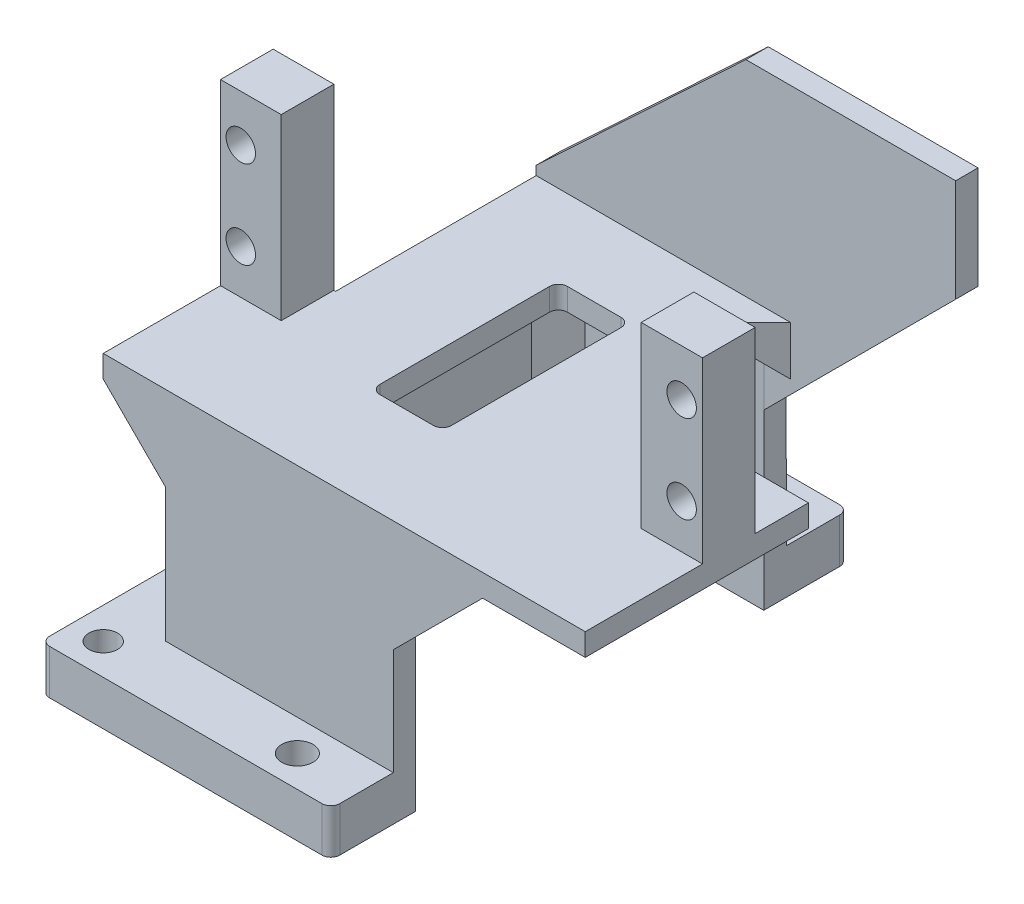
from build123d import *

# Parameters (mm, degrees)
BOSS_EXTRUDE1_DEPTH  = 3.5
BOSS_EXTRUDE2_DEPTH  = 21
SKETCH3_W            = 23
SKETCH3_H            = 39
BOSS_EXTRUDE3_DEPTH  = 2.5
SKETCH5_W            = 21.5
SKETCH5_H            = 25
SKETCH5_W_2          = 7.07
SKETCH5_H_2          = 19.04
BOSS_EXTRUDE5_DEPTH  = 2.5
SKETCH6_W            = 7.07
SKETCH6_H            = 5.9
BOSS_EXTRUDE6_DEPTH  = 20
BOSS_EXTRUDE7_DEPTH  = 23
FILLET1_SIZE         = 10
SKETCH9_R            = 2.475
BOSS_EXTRUDE8_DEPTH  = 9
FILLET2_R            = 0.5
SKETCH10_R           = 1.65
CUT_EXTRUDE1_DEPTH   = 9
SKETCH11_W           = 0.2
SKETCH11_H           = 20
CUT_EXTRUDE2_DEPTH   = 9
CUT_EXTRUDE3_DEPTH   = 9
FILLET3_SIZE         = 3
BOSS_EXTRUDE9_DEPTH  = 5
SKETCH14_R           = 1.747814763
SKETCH14_R_2         = 1.6
CUT_EXTRUDE4_DEPTH   = 15
SKETCH15_W           = 110
SKETCH15_H           = 3.5
CUT_EXTRUDE5_DEPTH   = 150
FILLET4_SIZE         = 7
FILLET5_SIZE         = 3
FILLET6_SIZE         = 3
SKETCH17_W           = 8
SKETCH17_H           = 21
CUT_EXTRUDE6_DEPTH   = 150
FILLET7_R            = 1
FILLET9_SIZE         = 3
SKETCH19_R           = 1.747814763
SKETCH19_R_2         = 1.6
BOSS_EXTRUDE10_DEPTH = 8.43
CUT_EXTRUDE7_DEPTH   = 8.43
FILLET10_R           = 1


# Some blends are built 0.0001 mm under size
with BuildPart() as part:
    # Sketch1 → Boss-Extrude1 (new body)
    with BuildSketch(Plane(origin=(0, 0, 0), x_dir=(1, 0, 0), z_dir=(0, 1, 0))):
        Polygon((0, 40), (23, 40), (23, 79), (0, 79), (0, 100), (110, 100), (110, 79), (87, 79), (87, 40), (110, 40), (110, 20), (80, 0), (30, 0), (0, 20), align=None)
    extrude(amount=BOSS_EXTRUDE1_DEPTH)

    # Sketch2 → Boss-Extrude2 (add)
    with BuildSketch(Plane(origin=(0, 3.5, 0), x_dir=(1, 0, 0), z_dir=(0, 1, 0))):
        Polygon((0, 79), (23, 79), (23, 40), (0, 40), (0, 37.5), (25.5, 37.5), (25.5, 81.5), (0, 81.5), align=None)
        Polygon((110, 81.5), (84.5, 81.5), (84.5, 37.5), (110, 37.5), (110, 40), (87, 40), (87, 79), (110, 79), align=None)
    extrude(amount=BOSS_EXTRUDE2_DEPTH)

    # Sketch3 → Boss-Extrude3 (add)
    with BuildSketch(Plane(origin=(0, 24.5, 0), x_dir=(1, 0, 0), z_dir=(0, 1, 0))):
        with Locations((11.5, 59.5)):
            Rectangle(SKETCH3_W, SKETCH3_H)
        with Locations((98.5, 59.5)):
            Rectangle(SKETCH3_W, SKETCH3_H)
    extrude(amount=-BOSS_EXTRUDE3_DEPTH)

    # Sketch5 → Boss-Extrude5 (add)
    with BuildSketch(Plane(origin=(0, 24.5, 0), x_dir=(1, 0, 0), z_dir=(0, 1, 0))):
        with Locations((120.75, 50)):
            Rectangle(SKETCH5_W, SKETCH5_H)
        with Locations((-10.75, 50)):
            Rectangle(SKETCH5_W, SKETCH5_H)
        with Locations((29.035, 47.02)):
            Rectangle(SKETCH5_W_2, SKETCH5_H_2)
        with Locations((80.965, 47.02)):
            Rectangle(SKETCH5_W_2, SKETCH5_H_2)
    extrude(amount=-BOSS_EXTRUDE5_DEPTH)

    # Sketch6 → Boss-Extrude6 (add)
    with BuildSketch(Plane(origin=(0, 24.5, 0), x_dir=(1, 0, 0), z_dir=(0, 1, 0))):
        with Locations((29.035, 53.59)):
            Rectangle(SKETCH6_W, SKETCH6_H)
        with Locations((80.965, 53.59)):
            Rectangle(SKETCH6_W, SKETCH6_H)
        with Locations((-17.965, 53.59)):
            Rectangle(SKETCH6_W, SKETCH6_H)
        with Locations((127.965, 53.59)):
            Rectangle(SKETCH6_W, SKETCH6_H)
    extrude(amount=BOSS_EXTRUDE6_DEPTH)

    # Sketch7 → Boss-Extrude7 (add)
    with BuildSketch(Plane(origin=(0, 24.5, 0), x_dir=(1, 0, 0), z_dir=(0, 1, 0))):
        Polygon((0, 81.5), (25.5, 81.5), (25.5, 79), (0, 79), (-21.5, 79), (-21.5, 81.5), align=None)
        Polygon((110, 79), (84.5, 79), (84.5, 81.5), (110, 81.5), (131.5, 81.5), (131.5, 79), align=None)
    extrude(amount=BOSS_EXTRUDE7_DEPTH)

    # Fillet1
    # the kernel refuses this chamfer: 10 mm, written as the material it adds along each edge
    with BuildSketch(Plane(origin=(0, 22, -40), x_dir=(0.027495876610586372, -0.9996219169112968, 0), z_dir=(0, 0, 1)), Plane(origin=(110, 22, -37.5), x_dir=(-0.027495876610586317, -0.9996219169112968, 0), z_dir=(0, 0, -1)), Plane(origin=(110, 24.5, -81.5), x_dir=(0.9996219169112968, 0.027495876610586317, 0), z_dir=(0, 0, 1))) as fillet1_piece_1:
        Polygon((FILLET1_SIZE * 0.999621916911, -FILLET1_SIZE * 0.0274958766106), (-FILLET1_SIZE * 0.0274958766106, -FILLET1_SIZE * 0.999621916911), (0, 0), align=None)
    extrude(amount=2.5)
    with BuildSketch(Plane(origin=(0, 24.5, -79), x_dir=(0.027495876610586372, -0.9996219169112968, 0), z_dir=(0, 0, -1))) as fillet1_piece_2:
        Polygon((FILLET1_SIZE * 0.999621916911, FILLET1_SIZE * 0.0274958766106), (-FILLET1_SIZE * 0.0274958766106, FILLET1_SIZE * 0.999621916911), (0, 0), align=None)
    extrude(amount=2.5)

    # Sketch9 → Boss-Extrude8 (add)
    with BuildSketch(Plane(origin=(0, 0, -81.5), x_dir=(-1, 0, 0), z_dir=(0, 0, -1))):
        with Locations(Location((-114.55, 34.35, 0), (0, 0, 180))):
            Circle(SKETCH9_R)
        with Locations(Location((4.55, 34.35, 0), (0, 0, 180))):
            Circle(SKETCH9_R)
    extrude(amount=BOSS_EXTRUDE8_DEPTH)

    # Fillet2
    fillet2_edges = [part.edges().sort_by_distance(p)[0] for p in [
        (112.075, 34.35, -90.5),
        (-7.025, 34.35, -90.5),
    ]]
    fillet(fillet2_edges, radius=FILLET2_R)

    # Sketch10 → Cut-Extrude1 (cut)
    with BuildSketch(Plane.XY.offset(-50.64)):
        with Locations((129.16, 39.27)):
            Circle(SKETCH10_R)
        with Locations((129.16, 29.43)):
            Circle(SKETCH10_R)
        with Locations((79.77, 39.27)):
            Circle(SKETCH10_R)
        with Locations((79.77, 29.43)):
            Circle(SKETCH10_R)
        with Locations((-19.16, 29.43)):
            Circle(SKETCH10_R)
        with Locations((-19.16, 39.27)):
            Circle(SKETCH10_R)
        with Locations(Location((30.23, 39.27, 0), (0, 0, 180))):
            Circle(SKETCH10_R)
        with Locations(Location((30.23, 29.43, 0), (0, 0, 180))):
            Circle(SKETCH10_R)
    extrude(amount=-CUT_EXTRUDE1_DEPTH, mode=Mode.SUBTRACT)

    # Sketch11 → Cut-Extrude2 (cut)
    with BuildSketch(Plane.XY.offset(-50.64)):
        with Locations((-14.53, 34.5)):
            Rectangle(SKETCH11_W, SKETCH11_H)
        with Locations((25.6, 34.5)):
            Rectangle(SKETCH11_W, SKETCH11_H)
        with Locations((84.4, 34.5)):
            Rectangle(SKETCH11_W, SKETCH11_H)
        with Locations((124.53, 34.5)):
            Rectangle(SKETCH11_W, SKETCH11_H)
    extrude(amount=-CUT_EXTRUDE2_DEPTH, mode=Mode.SUBTRACT)

    # Sketch12 → Cut-Extrude3 (cut)
    with BuildSketch(Plane(origin=(0, 0, -81.5), x_dir=(-1, 0, 0), z_dir=(0, 0, -1))):
        Polygon((-108, 47.5), (-84.5, 25.5), (-84.5, 47.5), align=None)
        Polygon((-25.5, 25.5), (-25.5, 47.5), (-2, 47.5), align=None)
        Polygon((-120, 24.5), (-131.5, 36), (-131.5, 24.5), align=None)
        Polygon((10, 24.5), (21.5, 36), (21.5, 24.5), align=None)
    extrude(amount=-CUT_EXTRUDE3_DEPTH, mode=Mode.SUBTRACT)

    # Fillet3
    fillet3_edges = [part.edges().sort_by_distance(p)[0] for p in [
        (0, 23.25, -62.5),
        (110, 23.25, -62.5),
    ]]
    chamfer(fillet3_edges, length=FILLET3_SIZE)

    # Sketch13 → Boss-Extrude9 (add)
    with BuildSketch(Plane(origin=(0, 3.5, 0), x_dir=(1, 0, 0), z_dir=(0, 1, 0))):
        Polygon((0, 30.5), (32.5, 30.5), (32.5, 88.5), (0, 88.5), (0, 81.5), (25.5, 81.5), (25.5, 37.5), (0, 37.5), align=None)
        Polygon((84.5, 37.5), (110, 37.5), (110, 30.5), (77.5, 30.5), (77.5, 88.5), (110, 88.5), (110, 81.5), (84.5, 81.5), align=None)
    extrude(amount=BOSS_EXTRUDE9_DEPTH)

    # Sketch14 → Cut-Extrude4 (cut)
    with BuildSketch(Plane(origin=(0, 8.5, 0), x_dir=(1, 0, 0), z_dir=(0, 1, 0))):
        with Locations(Location((7.25, 34, 0), (0, 0, 270))):
            Circle(SKETCH14_R)
        with Locations(Location((7.25, 85, 0), (0, 0, 270))):
            Circle(SKETCH14_R_2)
        with Locations(Location((29, 34, 0), (0, 0, 270))):
            Circle(SKETCH14_R_2)
        with Locations(Location((29, 59.5, 0), (0, 0, 270))):
            Circle(SKETCH14_R_2)
        with Locations(Location((29, 85, 0), (0, 0, 270))):
            Circle(SKETCH14_R_2)
        with Locations(Location((81, 34, 0), (0, 0, 90))):
            Circle(SKETCH14_R_2)
        with Locations(Location((102.75, 34, 0), (0, 0, 90))):
            Circle(SKETCH14_R)
        with Locations(Location((81, 59.5, 0), (0, 0, 90))):
            Circle(SKETCH14_R_2)
        with Locations(Location((81, 85, 0), (0, 0, 90))):
            Circle(SKETCH14_R_2)
        with Locations(Location((102.75, 85, 0), (0, 0, 90))):
            Circle(SKETCH14_R_2)
    extrude(amount=-CUT_EXTRUDE4_DEPTH, mode=Mode.SUBTRACT)

    # Sketch15 → Cut-Extrude5 (cut)
    with BuildSketch(Plane(origin=(0, 0, -100), x_dir=(-1, 0, 0), z_dir=(0, 0, -1))):
        Polygon((-77.5, 47.5), (-77.5, 3.5), (0, 3.5), (21.5, 3.5), (21.5, 47.5), align=None)
        with Locations((-55, 1.75)):
            Rectangle(SKETCH15_W, SKETCH15_H)
    extrude(amount=-CUT_EXTRUDE5_DEPTH, mode=Mode.SUBTRACT)

    # Fillet4
    fillet4_edges = [part.edges().sort_by_distance(p)[0] for p in [
        (84.5, 22, -47.02),
    ]]
    chamfer(fillet4_edges, length=FILLET4_SIZE - 0.0001)  # a hair under: the kernel refuses the full size

    # Fillet5
    fillet5_edges = [part.edges().sort_by_distance(p)[0] for p in [
        (87, 22, -59.5),
        (98.5, 22, -79),
        (103.5, 22, -40),
    ]]
    chamfer(fillet5_edges, length=FILLET5_SIZE)

    # Fillet6
    fillet6_edges = [part.edges().sort_by_distance(p)[0] for p in [
        (110, 21.75, -79),
    ]]
    chamfer(fillet6_edges, length=FILLET6_SIZE)

    # Sketch17 → Cut-Extrude6 (cut)
    with BuildSketch(Plane.XZ.offset(-22)):
        with Locations((100, -59.5)):
            Rectangle(SKETCH17_W, SKETCH17_H)
    extrude(amount=-CUT_EXTRUDE6_DEPTH, mode=Mode.SUBTRACT)

    # Fillet7
    fillet7_edges = [part.edges().sort_by_distance(p)[0] for p in [
        (96, 23.25, -70),
        (96, 23.25, -49),
        (104, 23.25, -49),
        (104, 23.25, -70),
    ]]
    fillet(fillet7_edges, radius=FILLET7_R)

    # Fillet9
    fillet9_edges = [part.edges().sort_by_distance(p)[0] for p in [
        (87, 11.25, -79),
        (87, 11.25, -40),
    ]]
    chamfer(fillet9_edges, length=FILLET9_SIZE)

    # Sketch19 → Boss-Extrude10 (add)
    with BuildSketch(Plane.XZ.offset(-3.5)):
        Polygon((110, -40), (110, -30.5), (77.5, -30.5), (77.5, -88.5), (110, -88.5), (110, -79), (90, -79), (87, -76), (87, -43), (90, -40), align=None)
        with Locations(Location((102.75, -34, 0), (0, 0, 270))):
            Circle(SKETCH19_R, mode=Mode.SUBTRACT)
        with Locations(Location((81, -34, 0), (0, 0, 270))):
            Circle(SKETCH19_R_2, mode=Mode.SUBTRACT)
        with Locations(Location((81, -59.5, 0), (0, 0, 270))):
            Circle(SKETCH19_R_2, mode=Mode.SUBTRACT)
        with Locations(Location((81, -85, 0), (0, 0, 270))):
            Circle(SKETCH19_R_2, mode=Mode.SUBTRACT)
        with Locations(Location((102.75, -85, 0), (0, 0, 270))):
            Circle(SKETCH19_R_2, mode=Mode.SUBTRACT)
    extrude(amount=BOSS_EXTRUDE10_DEPTH)

    # Sketch20 → Cut-Extrude7 (cut)
    with BuildSketch(Plane(origin=(0, 8.5, 0), x_dir=(1, 0, 0), z_dir=(0, 1, 0))):
        Polygon((110, 88.5), (77.5, 88.5), (77.5, 81.549434768), (77.5, 30.5), (84.5, 30.5), (110, 30.5), (110, 37.5), (84.5, 37.5), (84.5, 81.549434768), (110, 81.549434768), align=None)
    extrude(amount=-CUT_EXTRUDE7_DEPTH, mode=Mode.SUBTRACT)

    # Fillet10
    fillet10_edges = [part.edges().sort_by_distance(p)[0] for p in [
        (77.5, -2.43, -30.5),
        (110, -2.43, -30.5),
        (77.5, -2.43, -88.5),
        (110, -2.43, -88.5),
    ]]
    fillet(fillet10_edges, radius=FILLET10_R)


solid = part.part
